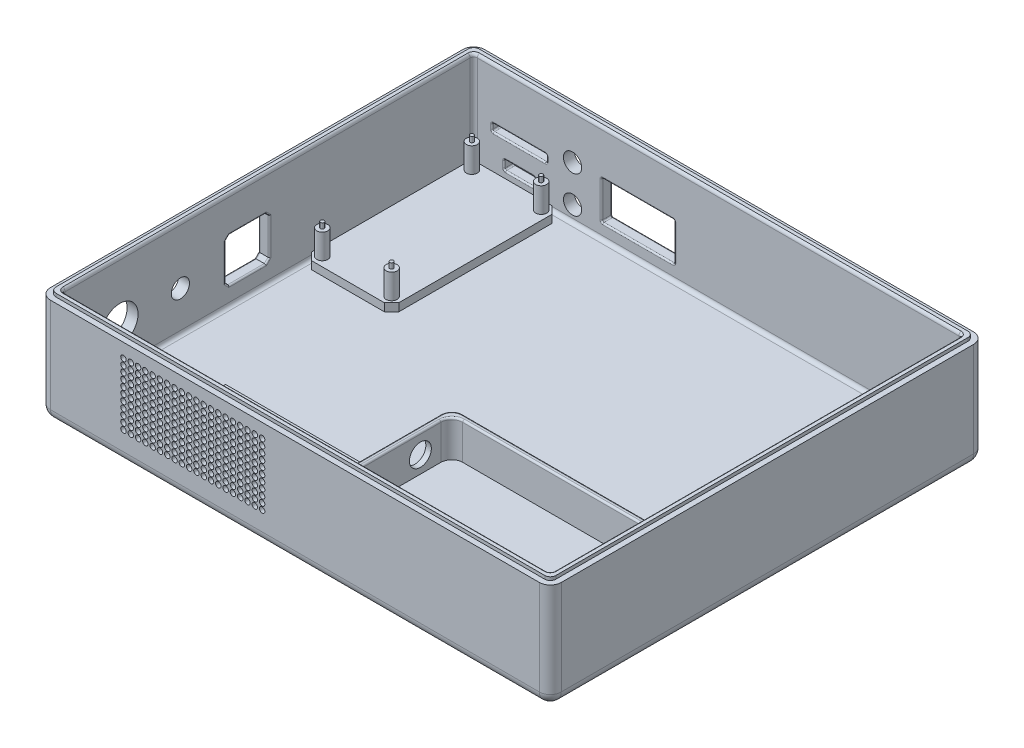
from build123d import *

# Parameters (mm, degrees)
SKETCH1_W            = 140
SKETCH1_H            = 119
BOSS_EXTRUDE1_DEPTH  = 30
SHELL1_T             = -3
FILLET13_R           = 1
FILLET2_R            = 3
SKETCH4_W            = 65.5
SKETCH4_H            = 40
BOSS_EXTRUDE2_DEPTH  = 10
SKETCH5_W            = 62.5
SKETCH5_H            = 37
CUT_EXTRUDE1_DEPTH   = 10
CUT_EXTRUDE13_DEPTH  = 1
CUT_EXTRUDE14_DEPTH  = 0.1
SKETCH22_W           = 15
SKETCH22_H           = 2
SKETCH22_W_2         = 8.35
SKETCH22_H_2         = 2.55
CUT_EXTRUDE15_DEPTH  = 60
SKETCH24_W           = 20
SKETCH24_H           = 10.5
CUT_EXTRUDE16_DEPTH  = 60
BOSS_EXTRUDE3_DEPTH  = 2.16
SKETCH28_R           = 1.5
BOSS_EXTRUDE4_DEPTH  = 6.8
SKETCH29_R           = 0.5
BOSS_EXTRUDE5_DEPTH  = 1.5
SKETCH25_W           = 39
SKETCH25_H           = 20
BOSS_EXTRUDE6_DEPTH  = 3
CUT_EXTRUDE17_DEPTH  = 12
SKETCH32_R           = 0.75
CUT_EXTRUDE19_DEPTH  = 6
FILLET14_R           = 0.4
FILLET15_R           = 0.4
FILLET16_R           = 0.4
SKETCH42_R           = 5
CUT_EXTRUDE24_DEPTH  = 12
SKETCH43_R           = 2.5
CUT_EXTRUDE25_DEPTH  = 12
SKETCH44_R           = 3
CUT_EXTRUDE26_DEPTH  = 12
FILLET18_R           = 3
SKETCH45_R           = 2.5
CUT_EXTRUDE27_DEPTH  = 12
FILLET19_R           = 0.5
BOSS_EXTRUDE10_DEPTH = 6
FILLET20_R           = 0.5
FILLET21_R           = 0.5


with BuildPart() as part:
    # Sketch1 → Boss-Extrude1 (new body)
    with BuildSketch(Plane(origin=(0, 0, 0), x_dir=(1, 0, 0), z_dir=(0, 1, 0))):
        Rectangle(SKETCH1_W, SKETCH1_H)
    extrude(amount=BOSS_EXTRUDE1_DEPTH)

    # Shell1
    shell1_openings = [part.faces().sort_by_distance(p)[0] for p in [
        (0, 30, 0),
    ]]
    offset(amount=SHELL1_T, openings=shell1_openings, kind=Kind.INTERSECTION)

    # Fillet13
    fillet13_edges = [part.edges().sort_by_distance(p)[0] for p in [
        (67, 3, 0),
        (67, 16.5, 56.5),
        (0, 3, -56.5),
        (67, 16.5, -56.5),
        (-67, 3, 0),
        (-67, 16.5, -56.5),
        (0, 3, 56.5),
        (-67, 16.5, 56.5),
        (67, 30, 0),
        (0, 30, -56.5),
        (-67, 30, 0),
        (0, 30, 56.5),
    ]]
    fillet(fillet13_edges, radius=FILLET13_R)

    # Fillet2
    fillet2_edges = [part.edges().sort_by_distance(p)[0] for p in [
        (0, 0, 59.5),
        (-70, 0, 0),
        (0, 0, -59.5),
        (70, 0, 0),
        (70, 15, 59.5),
        (-70, 15, 59.5),
        (-70, 15, -59.5),
        (70, 15, -59.5),
    ]]
    fillet(fillet2_edges, radius=FILLET2_R)

    # Sketch4 → Boss-Extrude2 (add)
    with BuildSketch(Plane(origin=(0, 3, 0), x_dir=(1, 0, 0), z_dir=(0, 1, 0))):
        with Locations((30.25, -34)):
            Rectangle(SKETCH4_W, SKETCH4_H)
    extrude(amount=BOSS_EXTRUDE2_DEPTH)

    # Sketch5 → Cut-Extrude1 (cut)
    with BuildSketch(Plane(origin=(0, 13, 0), x_dir=(1, 0, 0), z_dir=(0, 1, 0))):
        with Locations((30.25, -34)):
            Rectangle(SKETCH5_W, SKETCH5_H)
    extrude(amount=-CUT_EXTRUDE1_DEPTH, mode=Mode.SUBTRACT)

    # Sketch19 → Cut-Extrude13 (cut)
    with BuildSketch(Plane(origin=(0, 30, 0), x_dir=(1, 0, 0), z_dir=(0, 1, 0))):
        with BuildLine():
            Line((70, -56.5), (70, 56.5))
            ThreePointArc((70, 56.5), (69.121320344, 58.621320344), (67, 59.5))
            Line((67, 59.5), (-67, 59.5))
            ThreePointArc((-67, 59.5), (-69.121320344, 58.621320344), (-70, 56.5))
            Line((-70, 56.5), (-70, -56.5))
            ThreePointArc((-70, -56.5), (-69.121320344, -58.621320344), (-67, -59.5))
            Line((-67, -59.5), (67, -59.5))
            ThreePointArc((67, -59.5), (69.121320344, -58.621320344), (70, -56.5))
        make_face()
        with BuildLine():
            Line((68.5, -56.5), (68.5, 56.5))
            ThreePointArc((68.5, 56.5), (68.060660172, 57.560660172), (67, 58))
            Line((67, 58), (-67, 58))
            ThreePointArc((-67, 58), (-68.060660172, 57.560660172), (-68.5, 56.5))
            Line((-68.5, 56.5), (-68.5, -56.5))
            ThreePointArc((-68.5, -56.5), (-68.060660172, -57.560660172), (-67, -58))
            Line((-67, -58), (67, -58))
            ThreePointArc((67, -58), (68.060660172, -57.560660172), (68.5, -56.5))
        make_face(mode=Mode.SUBTRACT)
    extrude(amount=-CUT_EXTRUDE13_DEPTH, mode=Mode.SUBTRACT)

    # Sketch20 → Cut-Extrude14 (cut)
    with BuildSketch(Plane(origin=(0, 30, 0), x_dir=(1, 0, 0), z_dir=(0, 1, 0))):
        with BuildLine():
            Line((67, 58), (-67, 58))
            ThreePointArc((-67, 58), (-68.060660172, 57.560660172), (-68.5, 56.5))
            Line((-68.5, 56.5), (-68.5, -56.5))
            ThreePointArc((-68.5, -56.5), (-68.060660172, -57.560660172), (-67, -58))
            Line((-67, -58), (67, -58))
            ThreePointArc((67, -58), (68.060660172, -57.560660172), (68.5, -56.5))
            Line((68.5, -56.5), (68.5, 56.5))
            ThreePointArc((68.5, 56.5), (68.060660172, 57.560660172), (67, 58))
        make_face()
        with BuildLine():
            Line((67, -55.5), (67, 55.5))
            ThreePointArc((67, 55.5), (66.707106781, 56.207106781), (66, 56.5))
            Line((66, 56.5), (-66, 56.5))
            ThreePointArc((-66, 56.5), (-66.707106781, 56.207106781), (-67, 55.5))
            Line((-67, 55.5), (-67, -55.5))
            ThreePointArc((-67, -55.5), (-66.707106781, -56.207106781), (-66, -56.5))
            Line((-66, -56.5), (66, -56.5))
            ThreePointArc((66, -56.5), (66.707106781, -56.207106781), (67, -55.5))
        make_face(mode=Mode.SUBTRACT)
    extrude(amount=-CUT_EXTRUDE14_DEPTH, mode=Mode.SUBTRACT)

    # Sketch22 → Cut-Extrude15 (cut)
    with BuildSketch(Plane(origin=(0, 0, -59.5), x_dir=(-1, 0, 0), z_dir=(0, 0, -1))):
        with Locations((54.5, 14.55)):
            Rectangle(SKETCH22_W, SKETCH22_H)
        with Locations((54.5, 7.275)):
            Rectangle(SKETCH22_W_2, SKETCH22_H_2)
    extrude(amount=-CUT_EXTRUDE15_DEPTH, mode=Mode.SUBTRACT)

    # Sketch24 → Cut-Extrude16 (cut)
    with BuildSketch(Plane(origin=(0, 0, -59.5), x_dir=(-1, 0, 0), z_dir=(0, 0, -1))):
        with Locations((22, 12.25)):
            Rectangle(SKETCH24_W, SKETCH24_H)
    extrude(amount=-CUT_EXTRUDE16_DEPTH, mode=Mode.SUBTRACT)

    # Sketch27 → Boss-Extrude3 (add)
    with BuildSketch(Plane(origin=(0, 3, 0), x_dir=(1, 0, 0), z_dir=(0, 1, 0))):
        Polygon((-66.5, 53.5), (-64.5, 55.5), (-44.5, 55.5), (-42.5, 53.5), (-42.5, 11.5), (-44.5, 9.5), (-64.5, 9.5), (-66.5, 11.5), align=None)
    extrude(amount=BOSS_EXTRUDE3_DEPTH)

    # Sketch28 → Boss-Extrude4 (add)
    with BuildSketch(Plane(origin=(0, 5.16, 0), x_dir=(1, 0, 0), z_dir=(0, 1, 0))):
        with Locations(Location((-64, 53, 0), (0, 0, 90))):
            Circle(SKETCH28_R)
        with Locations(Location((-45, 53, 0), (0, 0, 90))):
            Circle(SKETCH28_R)
        with Locations(Location((-64, 12, 0), (0, 0, 90))):
            Circle(SKETCH28_R)
        with Locations(Location((-45, 12, 0), (0, 0, 90))):
            Circle(SKETCH28_R)
    extrude(amount=BOSS_EXTRUDE4_DEPTH)

    # Sketch29 → Boss-Extrude5 (add)
    with BuildSketch(Plane(origin=(0, 11.96, 0), x_dir=(1, 0, 0), z_dir=(0, 1, 0))):
        with Locations(Location((-64, 53, 0), (0, 0, 270))):
            Circle(SKETCH29_R)
        with Locations(Location((-45, 53, 0), (0, 0, 270))):
            Circle(SKETCH29_R)
        with Locations(Location((-64, 12, 0), (0, 0, 270))):
            Circle(SKETCH29_R)
        with Locations(Location((-45, 12, 0), (0, 0, 270))):
            Circle(SKETCH29_R)
    extrude(amount=BOSS_EXTRUDE5_DEPTH)

    # Sketch25 → Boss-Extrude6 (add)
    with BuildSketch(Plane(origin=(0, 3, 0), x_dir=(1, 0, 0), z_dir=(0, 1, 0))):
        with Locations((-26.5, -42.5)):
            Rectangle(SKETCH25_W, SKETCH25_H)
    extrude(amount=BOSS_EXTRUDE6_DEPTH)

    # Sketch31 → Cut-Extrude17 (cut)
    with BuildSketch(Plane.ZY.offset(70)):
        Polygon((0.5, 8), (10.5, 8), (11.5, 9), (11.5, 19), (10.5, 20), (0.5, 20), (-0.5, 19), (-0.5, 9), align=None)
    extrude(amount=-CUT_EXTRUDE17_DEPTH, mode=Mode.SUBTRACT)

    # Sketch32 → Cut-Extrude19 (cut)
    with BuildSketch(Plane.XY.offset(59.5)):
        with Locations((-47, 25.2)):
            Circle(SKETCH32_R)
        with Locations((-45, 25.2)):
            Circle(SKETCH32_R)
        with Locations((-43, 25.2)):
            Circle(SKETCH32_R)
        with Locations((-41, 25.2)):
            Circle(SKETCH32_R)
        with Locations((-39, 25.2)):
            Circle(SKETCH32_R)
        with Locations((-37, 25.2)):
            Circle(SKETCH32_R)
        with Locations((-35, 25.2)):
            Circle(SKETCH32_R)
        with Locations((-33, 25.2)):
            Circle(SKETCH32_R)
        with Locations((-31, 25.2)):
            Circle(SKETCH32_R)
        with Locations((-29, 25.2)):
            Circle(SKETCH32_R)
        with Locations((-27, 25.2)):
            Circle(SKETCH32_R)
        with Locations((-25, 25.2)):
            Circle(SKETCH32_R)
        with Locations((-23, 25.2)):
            Circle(SKETCH32_R)
        with Locations((-21, 25.2)):
            Circle(SKETCH32_R)
        with Locations((-19, 25.2)):
            Circle(SKETCH32_R)
        with Locations((-17, 25.2)):
            Circle(SKETCH32_R)
        with Locations((-15, 25.2)):
            Circle(SKETCH32_R)
        with Locations((-13, 25.2)):
            Circle(SKETCH32_R)
        with Locations((-11, 25.2)):
            Circle(SKETCH32_R)
        with Locations((-9, 25.2)):
            Circle(SKETCH32_R)
        with Locations((-45, 23.5)):
            Circle(SKETCH32_R)
        with Locations((-43, 23.5)):
            Circle(SKETCH32_R)
        with Locations((-41, 23.5)):
            Circle(SKETCH32_R)
        with Locations((-39, 23.5)):
            Circle(SKETCH32_R)
        with Locations((-37, 23.5)):
            Circle(SKETCH32_R)
        with Locations((-35, 23.5)):
            Circle(SKETCH32_R)
        with Locations((-33, 23.5)):
            Circle(SKETCH32_R)
        with Locations((-31, 23.5)):
            Circle(SKETCH32_R)
        with Locations((-29, 23.5)):
            Circle(SKETCH32_R)
        with Locations((-27, 23.5)):
            Circle(SKETCH32_R)
        with Locations((-25, 23.5)):
            Circle(SKETCH32_R)
        with Locations((-23, 23.5)):
            Circle(SKETCH32_R)
        with Locations((-21, 23.5)):
            Circle(SKETCH32_R)
        with Locations((-19, 23.5)):
            Circle(SKETCH32_R)
        with Locations((-17, 23.5)):
            Circle(SKETCH32_R)
        with Locations((-15, 23.5)):
            Circle(SKETCH32_R)
        with Locations((-13, 23.5)):
            Circle(SKETCH32_R)
        with Locations((-11, 23.5)):
            Circle(SKETCH32_R)
        with Locations((-9, 23.5)):
            Circle(SKETCH32_R)
        with Locations((-45, 21.8)):
            Circle(SKETCH32_R)
        with Locations((-43, 21.8)):
            Circle(SKETCH32_R)
        with Locations((-41, 21.8)):
            Circle(SKETCH32_R)
        with Locations((-39, 21.8)):
            Circle(SKETCH32_R)
        with Locations((-37, 21.8)):
            Circle(SKETCH32_R)
        with Locations((-35, 21.8)):
            Circle(SKETCH32_R)
        with Locations((-33, 21.8)):
            Circle(SKETCH32_R)
        with Locations((-31, 21.8)):
            Circle(SKETCH32_R)
        with Locations((-29, 21.8)):
            Circle(SKETCH32_R)
        with Locations((-27, 21.8)):
            Circle(SKETCH32_R)
        with Locations((-25, 21.8)):
            Circle(SKETCH32_R)
        with Locations((-23, 21.8)):
            Circle(SKETCH32_R)
        with Locations((-21, 21.8)):
            Circle(SKETCH32_R)
        with Locations((-19, 21.8)):
            Circle(SKETCH32_R)
        with Locations((-17, 21.8)):
            Circle(SKETCH32_R)
        with Locations((-15, 21.8)):
            Circle(SKETCH32_R)
        with Locations((-13, 21.8)):
            Circle(SKETCH32_R)
        with Locations((-11, 21.8)):
            Circle(SKETCH32_R)
        with Locations((-9, 21.8)):
            Circle(SKETCH32_R)
        with Locations((-45, 20.1)):
            Circle(SKETCH32_R)
        with Locations((-43, 20.1)):
            Circle(SKETCH32_R)
        with Locations((-41, 20.1)):
            Circle(SKETCH32_R)
        with Locations((-39, 20.1)):
            Circle(SKETCH32_R)
        with Locations((-37, 20.1)):
            Circle(SKETCH32_R)
        with Locations((-35, 20.1)):
            Circle(SKETCH32_R)
        with Locations((-33, 20.1)):
            Circle(SKETCH32_R)
        with Locations((-31, 20.1)):
            Circle(SKETCH32_R)
        with Locations((-29, 20.1)):
            Circle(SKETCH32_R)
        with Locations((-27, 20.1)):
            Circle(SKETCH32_R)
        with Locations((-25, 20.1)):
            Circle(SKETCH32_R)
        with Locations((-23, 20.1)):
            Circle(SKETCH32_R)
        with Locations((-21, 20.1)):
            Circle(SKETCH32_R)
        with Locations((-19, 20.1)):
            Circle(SKETCH32_R)
        with Locations((-17, 20.1)):
            Circle(SKETCH32_R)
        with Locations((-15, 20.1)):
            Circle(SKETCH32_R)
        with Locations((-13, 20.1)):
            Circle(SKETCH32_R)
        with Locations((-11, 20.1)):
            Circle(SKETCH32_R)
        with Locations((-9, 20.1)):
            Circle(SKETCH32_R)
        with Locations((-45, 18.4)):
            Circle(SKETCH32_R)
        with Locations((-43, 18.4)):
            Circle(SKETCH32_R)
        with Locations((-41, 18.4)):
            Circle(SKETCH32_R)
        with Locations((-39, 18.4)):
            Circle(SKETCH32_R)
        with Locations((-37, 18.4)):
            Circle(SKETCH32_R)
        with Locations((-35, 18.4)):
            Circle(SKETCH32_R)
        with Locations((-33, 18.4)):
            Circle(SKETCH32_R)
        with Locations((-31, 18.4)):
            Circle(SKETCH32_R)
        with Locations((-29, 18.4)):
            Circle(SKETCH32_R)
        with Locations((-27, 18.4)):
            Circle(SKETCH32_R)
        with Locations((-25, 18.4)):
            Circle(SKETCH32_R)
        with Locations((-23, 18.4)):
            Circle(SKETCH32_R)
        with Locations((-21, 18.4)):
            Circle(SKETCH32_R)
        with Locations((-19, 18.4)):
            Circle(SKETCH32_R)
        with Locations((-17, 18.4)):
            Circle(SKETCH32_R)
        with Locations((-15, 18.4)):
            Circle(SKETCH32_R)
        with Locations((-13, 18.4)):
            Circle(SKETCH32_R)
        with Locations((-11, 18.4)):
            Circle(SKETCH32_R)
        with Locations((-9, 18.4)):
            Circle(SKETCH32_R)
        with Locations((-45, 16.7)):
            Circle(SKETCH32_R)
        with Locations((-43, 16.7)):
            Circle(SKETCH32_R)
        with Locations((-41, 16.7)):
            Circle(SKETCH32_R)
        with Locations((-39, 16.7)):
            Circle(SKETCH32_R)
        with Locations((-37, 16.7)):
            Circle(SKETCH32_R)
        with Locations((-35, 16.7)):
            Circle(SKETCH32_R)
        with Locations((-33, 16.7)):
            Circle(SKETCH32_R)
        with Locations((-31, 16.7)):
            Circle(SKETCH32_R)
        with Locations((-29, 16.7)):
            Circle(SKETCH32_R)
        with Locations((-27, 16.7)):
            Circle(SKETCH32_R)
        with Locations((-25, 16.7)):
            Circle(SKETCH32_R)
        with Locations((-23, 16.7)):
            Circle(SKETCH32_R)
        with Locations((-21, 16.7)):
            Circle(SKETCH32_R)
        with Locations((-19, 16.7)):
            Circle(SKETCH32_R)
        with Locations((-17, 16.7)):
            Circle(SKETCH32_R)
        with Locations((-15, 16.7)):
            Circle(SKETCH32_R)
        with Locations((-13, 16.7)):
            Circle(SKETCH32_R)
        with Locations((-11, 16.7)):
            Circle(SKETCH32_R)
        with Locations((-9, 16.7)):
            Circle(SKETCH32_R)
        with Locations((-45, 15)):
            Circle(SKETCH32_R)
        with Locations((-43, 15)):
            Circle(SKETCH32_R)
        with Locations((-41, 15)):
            Circle(SKETCH32_R)
        with Locations((-39, 15)):
            Circle(SKETCH32_R)
        with Locations((-37, 15)):
            Circle(SKETCH32_R)
        with Locations((-35, 15)):
            Circle(SKETCH32_R)
        with Locations((-33, 15)):
            Circle(SKETCH32_R)
        with Locations((-31, 15)):
            Circle(SKETCH32_R)
        with Locations((-29, 15)):
            Circle(SKETCH32_R)
        with Locations((-27, 15)):
            Circle(SKETCH32_R)
        with Locations((-25, 15)):
            Circle(SKETCH32_R)
        with Locations((-23, 15)):
            Circle(SKETCH32_R)
        with Locations((-21, 15)):
            Circle(SKETCH32_R)
        with Locations((-19, 15)):
            Circle(SKETCH32_R)
        with Locations((-17, 15)):
            Circle(SKETCH32_R)
        with Locations((-15, 15)):
            Circle(SKETCH32_R)
        with Locations((-13, 15)):
            Circle(SKETCH32_R)
        with Locations((-11, 15)):
            Circle(SKETCH32_R)
        with Locations((-9, 15)):
            Circle(SKETCH32_R)
        with Locations((-45, 13.3)):
            Circle(SKETCH32_R)
        with Locations((-43, 13.3)):
            Circle(SKETCH32_R)
        with Locations((-41, 13.3)):
            Circle(SKETCH32_R)
        with Locations((-39, 13.3)):
            Circle(SKETCH32_R)
        with Locations((-37, 13.3)):
            Circle(SKETCH32_R)
        with Locations((-35, 13.3)):
            Circle(SKETCH32_R)
        with Locations((-33, 13.3)):
            Circle(SKETCH32_R)
        with Locations((-31, 13.3)):
            Circle(SKETCH32_R)
        with Locations((-29, 13.3)):
            Circle(SKETCH32_R)
        with Locations((-27, 13.3)):
            Circle(SKETCH32_R)
        with Locations((-25, 13.3)):
            Circle(SKETCH32_R)
        with Locations((-23, 13.3)):
            Circle(SKETCH32_R)
        with Locations((-21, 13.3)):
            Circle(SKETCH32_R)
        with Locations((-19, 13.3)):
            Circle(SKETCH32_R)
        with Locations((-17, 13.3)):
            Circle(SKETCH32_R)
        with Locations((-15, 13.3)):
            Circle(SKETCH32_R)
        with Locations((-13, 13.3)):
            Circle(SKETCH32_R)
        with Locations((-11, 13.3)):
            Circle(SKETCH32_R)
        with Locations((-9, 13.3)):
            Circle(SKETCH32_R)
        with Locations((-45, 11.6)):
            Circle(SKETCH32_R)
        with Locations((-43, 11.6)):
            Circle(SKETCH32_R)
        with Locations((-41, 11.6)):
            Circle(SKETCH32_R)
        with Locations((-39, 11.6)):
            Circle(SKETCH32_R)
        with Locations((-37, 11.6)):
            Circle(SKETCH32_R)
        with Locations((-35, 11.6)):
            Circle(SKETCH32_R)
        with Locations((-33, 11.6)):
            Circle(SKETCH32_R)
        with Locations((-31, 11.6)):
            Circle(SKETCH32_R)
        with Locations((-29, 11.6)):
            Circle(SKETCH32_R)
        with Locations((-27, 11.6)):
            Circle(SKETCH32_R)
        with Locations((-25, 11.6)):
            Circle(SKETCH32_R)
        with Locations((-23, 11.6)):
            Circle(SKETCH32_R)
        with Locations((-21, 11.6)):
            Circle(SKETCH32_R)
        with Locations((-19, 11.6)):
            Circle(SKETCH32_R)
        with Locations((-17, 11.6)):
            Circle(SKETCH32_R)
        with Locations((-15, 11.6)):
            Circle(SKETCH32_R)
        with Locations((-13, 11.6)):
            Circle(SKETCH32_R)
        with Locations((-11, 11.6)):
            Circle(SKETCH32_R)
        with Locations((-9, 11.6)):
            Circle(SKETCH32_R)
        with Locations((-45, 9.9)):
            Circle(SKETCH32_R)
        with Locations((-43, 9.9)):
            Circle(SKETCH32_R)
        with Locations((-41, 9.9)):
            Circle(SKETCH32_R)
        with Locations((-39, 9.9)):
            Circle(SKETCH32_R)
        with Locations((-37, 9.9)):
            Circle(SKETCH32_R)
        with Locations((-35, 9.9)):
            Circle(SKETCH32_R)
        with Locations((-33, 9.9)):
            Circle(SKETCH32_R)
        with Locations((-31, 9.9)):
            Circle(SKETCH32_R)
        with Locations((-29, 9.9)):
            Circle(SKETCH32_R)
        with Locations((-27, 9.9)):
            Circle(SKETCH32_R)
        with Locations((-25, 9.9)):
            Circle(SKETCH32_R)
        with Locations((-23, 9.9)):
            Circle(SKETCH32_R)
        with Locations((-21, 9.9)):
            Circle(SKETCH32_R)
        with Locations((-19, 9.9)):
            Circle(SKETCH32_R)
        with Locations((-17, 9.9)):
            Circle(SKETCH32_R)
        with Locations((-15, 9.9)):
            Circle(SKETCH32_R)
        with Locations((-13, 9.9)):
            Circle(SKETCH32_R)
        with Locations((-11, 9.9)):
            Circle(SKETCH32_R)
        with Locations((-9, 9.9)):
            Circle(SKETCH32_R)
        with Locations((-45, 8.2)):
            Circle(SKETCH32_R)
        with Locations((-43, 8.2)):
            Circle(SKETCH32_R)
        with Locations((-41, 8.2)):
            Circle(SKETCH32_R)
        with Locations((-39, 8.2)):
            Circle(SKETCH32_R)
        with Locations((-37, 8.2)):
            Circle(SKETCH32_R)
        with Locations((-35, 8.2)):
            Circle(SKETCH32_R)
        with Locations((-33, 8.2)):
            Circle(SKETCH32_R)
        with Locations((-31, 8.2)):
            Circle(SKETCH32_R)
        with Locations((-29, 8.2)):
            Circle(SKETCH32_R)
        with Locations((-27, 8.2)):
            Circle(SKETCH32_R)
        with Locations((-25, 8.2)):
            Circle(SKETCH32_R)
        with Locations((-23, 8.2)):
            Circle(SKETCH32_R)
        with Locations((-21, 8.2)):
            Circle(SKETCH32_R)
        with Locations((-19, 8.2)):
            Circle(SKETCH32_R)
        with Locations((-17, 8.2)):
            Circle(SKETCH32_R)
        with Locations((-15, 8.2)):
            Circle(SKETCH32_R)
        with Locations((-13, 8.2)):
            Circle(SKETCH32_R)
        with Locations((-11, 8.2)):
            Circle(SKETCH32_R)
        with Locations((-9, 8.2)):
            Circle(SKETCH32_R)
        with Locations((-47, 23.5)):
            Circle(SKETCH32_R)
        with Locations((-47, 21.8)):
            Circle(SKETCH32_R)
        with Locations((-47, 20.1)):
            Circle(SKETCH32_R)
        with Locations((-47, 18.4)):
            Circle(SKETCH32_R)
        with Locations((-47, 16.7)):
            Circle(SKETCH32_R)
        with Locations((-47, 15)):
            Circle(SKETCH32_R)
        with Locations((-47, 13.3)):
            Circle(SKETCH32_R)
        with Locations((-47, 11.6)):
            Circle(SKETCH32_R)
        with Locations((-47, 9.9)):
            Circle(SKETCH32_R)
        with Locations((-47, 8.2)):
            Circle(SKETCH32_R)
    extrude(amount=-CUT_EXTRUDE19_DEPTH, mode=Mode.SUBTRACT)

    # Fillet14
    fillet14_edges = [part.edges().sort_by_distance(p)[0] for p in [
        (-67, 19.5, 0),
        (-67, 20, 5.5),
        (-67, 19.5, 11),
        (-67, 14, 11.5),
        (-67, 8.5, 11),
        (-67, 8, 5.5),
        (-67, 8.5, 0),
        (-67, 14, -0.5),
        (-70, 19.5, 0),
        (-70, 14, -0.5),
        (-70, 8.5, 0),
        (-70, 8, 5.5),
        (-70, 8.5, 11),
        (-70, 14, 11.5),
        (-70, 19.5, 11),
        (-70, 20, 5.5),
    ]]
    fillet(fillet14_edges, radius=FILLET14_R)

    # Fillet15
    fillet15_edges = [part.edges().sort_by_distance(p)[0] for p in [
        (-32, 12.25, -56.5),
        (-22, 7, -56.5),
        (-12, 12.25, -56.5),
        (-22, 17.5, -56.5),
        (-32, 17.5, -58),
        (-32, 7, -58),
        (-12, 7, -58),
        (-12, 17.5, -58),
        (-32, 12.25, -59.5),
        (-22, 17.5, -59.5),
        (-12, 12.25, -59.5),
        (-22, 7, -59.5),
    ]]
    fillet(fillet15_edges, radius=FILLET15_R)

    # Fillet16
    fillet16_edges = [part.edges().sort_by_distance(p)[0] for p in [
        (-62, 14.55, -56.5),
        (-54.5, 13.55, -56.5),
        (-47, 14.55, -56.5),
        (-54.5, 15.55, -56.5),
        (-62, 15.55, -58),
        (-62, 13.55, -58),
        (-47, 13.55, -58),
        (-47, 15.55, -58),
        (-62, 14.55, -59.5),
        (-54.5, 15.55, -59.5),
        (-47, 14.55, -59.5),
        (-54.5, 13.55, -59.5),
        (-58.675, 7.275, -56.5),
        (-54.5, 6, -56.5),
        (-50.325, 7.275, -56.5),
        (-54.5, 8.55, -56.5),
        (-58.675, 8.55, -58),
        (-58.675, 6, -58),
        (-50.325, 6, -58),
        (-50.325, 8.55, -58),
        (-58.675, 7.275, -59.5),
        (-54.5, 8.55, -59.5),
        (-50.325, 7.275, -59.5),
        (-54.5, 6, -59.5),
    ]]
    fillet(fillet16_edges, radius=FILLET16_R)

    # Sketch42 → Cut-Extrude24 (cut)
    with BuildSketch(Plane(origin=(-67, 0, 0), x_dir=(0, 0, -1), z_dir=(1, 0, 0))):
        with Locations((-40.5, 13.734677929)):
            Circle(SKETCH42_R)
    extrude(amount=-CUT_EXTRUDE24_DEPTH, mode=Mode.SUBTRACT)

    # Sketch43 → Cut-Extrude25 (cut)
    with BuildSketch(Plane(origin=(-67, 0, 0), x_dir=(0, 0, -1), z_dir=(1, 0, 0))):
        with Locations((-23.9, 14)):
            Circle(SKETCH43_R)
    extrude(amount=-CUT_EXTRUDE25_DEPTH, mode=Mode.SUBTRACT)

    # Sketch44 → Cut-Extrude26 (cut)
    with BuildSketch(Plane.ZY.offset(2.5)):
        with Locations((24.113262364, 7.620570405)):
            Circle(SKETCH44_R)
    extrude(amount=-CUT_EXTRUDE26_DEPTH, mode=Mode.SUBTRACT)

    # Fillet18
    fillet18_edges = [part.edges().sort_by_distance(p)[0] for p in [
        (63, 8, 54),
        (63, 8, 14),
        (-2.5, 8, 14),
        (-2.5, 8, 54),
        (61.5, 8, 15.5),
        (-1, 8, 15.5),
        (-1, 8, 52.5),
        (61.5, 8, 52.5),
    ]]
    fillet(fillet18_edges, radius=FILLET18_R)

    # Sketch45 → Cut-Extrude27 (cut)
    with BuildSketch(Plane(origin=(0, 0, -59.5), x_dir=(-1, 0, 0), z_dir=(0, 0, -1))):
        with Locations((39.9, 17.25)):
            Circle(SKETCH45_R)
        with Locations((39.9, 7.25)):
            Circle(SKETCH45_R)
    extrude(amount=-CUT_EXTRUDE27_DEPTH, mode=Mode.SUBTRACT)

    # Fillet19
    fillet19_edges = [part.edges().sort_by_distance(p)[0] for p in [
        (-2.5, 13, 34),
        (30.25, 13, 14),
        (61.5, 13, 34),
        (30.25, 13, 52.5),
        (-1, 13, 34),
        (30.25, 13, 15.5),
        (63, 13, 34),
        (30.25, 13, 54),
        (62.121320344, 13, 14.878679656),
        (62.121320344, 13, 53.121320344),
        (-1.621320344, 13, 53.121320344),
        (-1.621320344, 13, 14.878679656),
        (60.621320344, 13, 51.621320344),
        (60.621320344, 13, 16.378679656),
        (-0.121320344, 13, 51.621320344),
        (-0.121320344, 13, 16.378679656),
    ]]
    fillet(fillet19_edges, radius=FILLET19_R)

    # Sketch48 → Boss-Extrude10 (add, symmetric)
    with BuildSketch(Plane.XY):
        Polygon((-20, 0), (-20, -6), (20, -6), (20, 0), (24, 0), (24, -10), (-24, -10), (-24, 0), align=None)
    extrude(amount=BOSS_EXTRUDE10_DEPTH, both=True)

    # Fillet20
    fillet20_edges = [part.edges().sort_by_distance(p)[0] for p in [
        (-24, -5, -6),
        (0, -10, -6),
        (-24, -10, 0),
        (24, -5, -6),
        (24, -10, 0),
        (20, -3, -6),
        (0, -6, -6),
        (20, -6, 0),
        (-20, -3, -6),
        (-20, -6, 0),
        (-24, -5, 6),
        (0, -10, 6),
        (24, -5, 6),
        (20, -3, 6),
        (0, -6, 6),
        (-20, -3, 6),
    ]]
    fillet(fillet20_edges, radius=FILLET20_R)

    # Fillet21
    fillet21_edges = [part.edges().sort_by_distance(p)[0] for p in [
        (-24, 0, 0),
        (-22, 0, -6),
        (22, 0, -6),
        (24, 0, 0),
        (20, 0, 0),
        (-20, 0, 0),
        (-22, 0, 6),
        (22, 0, 6),
        (-23.853553391, 0, -5.853553391),
        (23.853553391, 0, -5.853553391),
        (20.146446609, 0, -5.853553391),
        (-20.146446609, 0, -5.853553391),
        (23.853553391, 0, 5.853553391),
        (20.146446609, 0, 5.853553391),
        (-20.146446609, 0, 5.853553391),
        (-23.853553391, 0, 5.853553391),
    ]]
    fillet(fillet21_edges, radius=FILLET21_R)


solid = part.part
